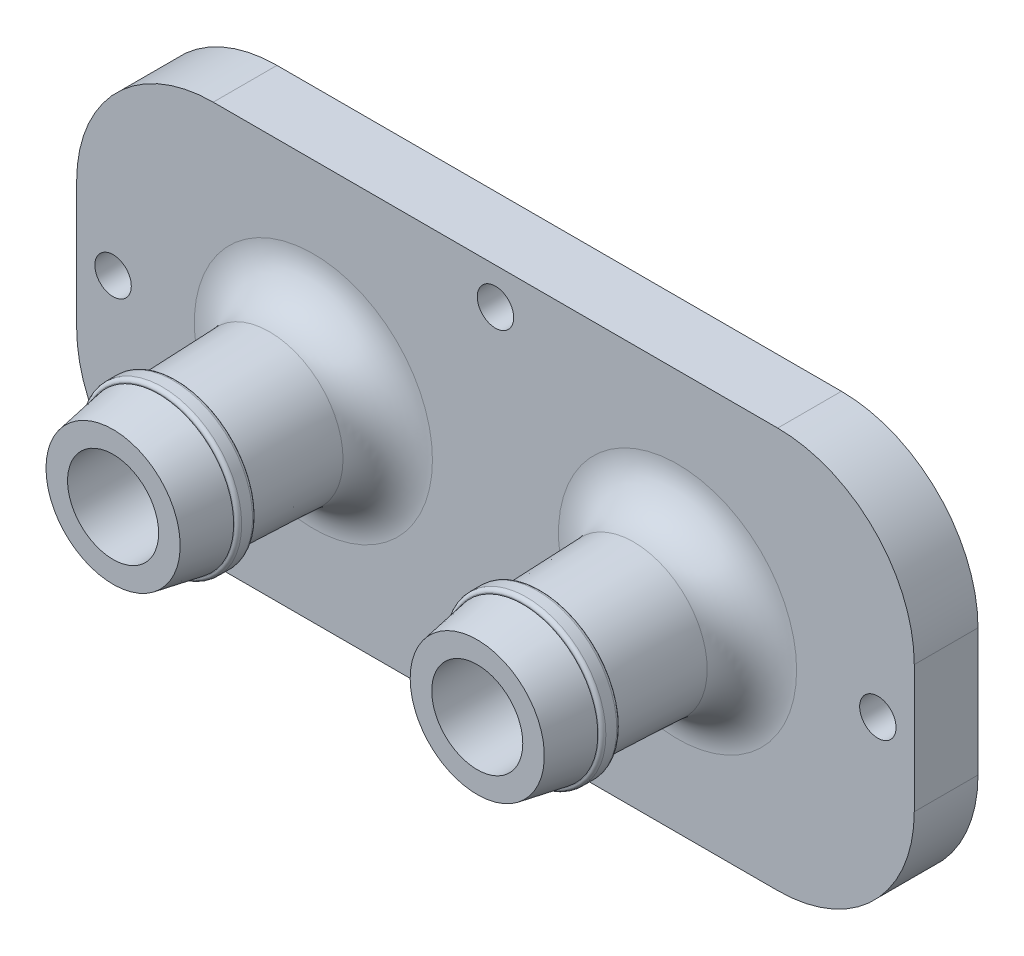
from build123d import *

# Parameters (mm, degrees)
SKETCH1_W           = 92
SKETCH1_H           = 44
SKETCH1_R           = 17
BOSS_EXTRUDE1_DEPTH = 4
FILLET1_R           = 15
BOSS_EXTRUDE2_START = 3
SKETCH2_R           = 5
BOSS_EXTRUDE2_DEPTH = 3
BOSS_EXTRUDE3_START = 15
SKETCH3_R           = 7.25
SKETCH3_R_2         = 5
BOSS_EXTRUDE3_DEPTH = 15
CHAMFER1_SIZE       = 1
CHAMFER1_SIZE_2     = 28.636253283
FILLET2_R           = 2
FILLET3_R           = 10
FILLET4_R           = 5
BOSS_EXTRUDE4_START = 2
SKETCH4_R           = 8.726188458
SKETCH4_R_2         = 5
BOSS_EXTRUDE4_DEPTH = 2
BOSS_EXTRUDE5_START = 5
SKETCH6_R           = 7.25
SKETCH6_R_2         = 5
BOSS_EXTRUDE5_DEPTH = 5
FILLET5_R           = 0.4
CHAMFER2_SIZE       = 1
CHAMFER2_SIZE_2     = 5.67128182
SKETCH8_R           = 2
CUT_EXTRUDE1_DEPTH  = 56.533773508


# Some blends are built 0.0001 mm under size
with BuildPart() as part:
    # Sketch1 → Boss-Extrude1 (new body)
    with BuildSketch(Plane.XY):
        Rectangle(SKETCH1_W, SKETCH1_H)
        with Locations((20, 0)):
            Circle(SKETCH1_R, mode=Mode.SUBTRACT)
        with Locations((-20, 0)):
            Circle(SKETCH1_R, mode=Mode.SUBTRACT)
    extrude(amount=BOSS_EXTRUDE1_DEPTH)

    # Fillet1
    fillet1_edges = [part.edges().sort_by_distance(p)[0] for p in [
        (-46, 22, 2),
        (46, 22, 2),
        (46, -22, 2),
        (-46, -22, 2),
    ]]
    fillet(fillet1_edges, radius=FILLET1_R)

    # Sketch2 → Boss-Extrude2 (add)
    with BuildSketch(Plane.XY.offset(4).offset(BOSS_EXTRUDE2_START)):
        with BuildLine():
            Line((-46, 7), (-46, -7))
            ThreePointArc((-46, -7), (-41.606601718, -17.606601718), (-31, -22))
            Line((-31, -22), (31, -22))
            ThreePointArc((31, -22), (41.606601718, -17.606601718), (46, -7))
            Line((46, -7), (46, 7))
            ThreePointArc((46, 7), (41.606601718, 17.606601718), (31, 22))
            Line((31, 22), (-31, 22))
            ThreePointArc((-31, 22), (-41.606601718, 17.606601718), (-46, 7))
        make_face()
        with Locations((-20, 0)):
            Circle(SKETCH2_R, mode=Mode.SUBTRACT)
        with Locations((20, 0)):
            Circle(SKETCH2_R, mode=Mode.SUBTRACT)
    extrude(amount=-BOSS_EXTRUDE2_DEPTH)

    # Sketch3 → Boss-Extrude3 (add)
    # profile 1 of 2: a face of its own
    with BuildSketch(Plane.XY.offset(7).offset(BOSS_EXTRUDE3_START)):
        with Locations((-20, 0)):
            Circle(SKETCH3_R)
        with Locations((-20, 0)):
            Circle(SKETCH3_R_2, mode=Mode.SUBTRACT)
    # profile 2 of 2: a face of its own
    with BuildSketch(Plane.XY.offset(7).offset(BOSS_EXTRUDE3_START)):
        with Locations((20, 0)):
            Circle(SKETCH3_R)
        with Locations((20, 0)):
            Circle(SKETCH3_R_2, mode=Mode.SUBTRACT)
    extrude(amount=-BOSS_EXTRUDE3_DEPTH)

    # Chamfer1
    # the kernel refuses this chamfer: 28.636253283, 1 mm, written as the material it adds along each edge
    with BuildSketch(Plane(origin=(-20, 0, 7), x_dir=(1, 0, 0), z_dir=(0, -1, 0))) as chamfer1_piece_1_section:
        Polygon((7.25 + CHAMFER1_SIZE, 0), (7.25, CHAMFER1_SIZE_2), (7.25, 0), align=None)
    chamfer1_piece_1 = revolve(axis=Axis((-20, 0, 7), (0, 0, 1)), mode=Mode.PRIVATE)
    chamfer1_piece_1 = split(chamfer1_piece_1, bisect_by=Plane(origin=(-27.910107183, 0, 22), z_dir=(0, 0, -1)), keep=Keep.TOP, mode=Mode.PRIVATE)
    add(chamfer1_piece_1)
    with BuildSketch(Plane(origin=(20, 0, 7), x_dir=(1, 0, 0), z_dir=(0, -1, 0))) as chamfer1_piece_2_section:
        Polygon((7.25 + CHAMFER1_SIZE, 0), (7.25, CHAMFER1_SIZE_2), (7.25, 0), align=None)
    chamfer1_piece_2 = revolve(axis=Axis((20, 0, 7), (0, 0, 1)), mode=Mode.PRIVATE)
    chamfer1_piece_2 = split(chamfer1_piece_2, bisect_by=Plane(origin=(12.089892824, 0, 22), z_dir=(0, 0, -1)), keep=Keep.TOP, mode=Mode.PRIVATE)
    add(chamfer1_piece_2)

    # Fillet2
    fillet2_edges = [part.edges().sort_by_distance(p)[0] for p in [
        (3, 0, 4),
        (-37, 0, 4),
    ]]
    fillet(fillet2_edges, radius=FILLET2_R)

    # Fillet3
    fillet3_edges = [part.edges().sort_by_distance(p)[0] for p in [
        (15, 0, 4),
        (-25, 0, 4),
    ]]
    fillet(fillet3_edges, radius=FILLET3_R - 0.0001)  # a hair under: the kernel refuses the full size

    # Fillet4
    fillet4_edges = [part.edges().sort_by_distance(p)[0] for p in [
        (11.75, 0, 7),
        (-28.25, 0, 7),
    ]]
    fillet(fillet4_edges, radius=FILLET4_R)

    # Sketch4 → Boss-Extrude4 (add)
    # profile 1 of 2: a face of its own
    with BuildSketch(Plane.XY.offset(22).offset(BOSS_EXTRUDE4_START)):
        with Locations((-20, 0)):
            Circle(SKETCH4_R)
        with Locations((-20, 0)):
            Circle(SKETCH4_R_2, mode=Mode.SUBTRACT)
    # profile 2 of 2: a face of its own
    with BuildSketch(Plane.XY.offset(22).offset(BOSS_EXTRUDE4_START)):
        with Locations((20, 0)):
            Circle(SKETCH4_R)
        with Locations((20, 0)):
            Circle(SKETCH4_R_2, mode=Mode.SUBTRACT)
    extrude(amount=-BOSS_EXTRUDE4_DEPTH)

    # Sketch6 → Boss-Extrude5 (add)
    # profile 1 of 2: a face of its own
    with BuildSketch(Plane.XY.offset(24).offset(BOSS_EXTRUDE5_START)):
        with Locations((20, 0)):
            Circle(SKETCH6_R)
        with Locations((20, 0)):
            Circle(SKETCH6_R_2, mode=Mode.SUBTRACT)
    # profile 2 of 2: a face of its own
    with BuildSketch(Plane.XY.offset(24).offset(BOSS_EXTRUDE5_START)):
        with Locations((-20, 0)):
            Circle(SKETCH6_R)
        with Locations((-20, 0)):
            Circle(SKETCH6_R_2, mode=Mode.SUBTRACT)
    extrude(amount=-BOSS_EXTRUDE5_DEPTH)

    # Fillet5
    fillet5_edges = [part.edges().sort_by_distance(p)[0] for p in [
        (-28.726188458, 0, 24),
        (-28.726188458, 0, 22),
        (11.273811542, 0, 24),
        (11.273811542, 0, 22),
        (-27.726188458, 0, 22),
        (12.273811542, 0, 22),
    ]]
    fillet(fillet5_edges, radius=FILLET5_R)

    # Chamfer2
    # the kernel refuses this chamfer: 5.67128182, 1 mm, written as the material it adds along each edge
    with BuildSketch(Plane(origin=(20, 0, 24), x_dir=(1, 0, 0), z_dir=(0, -1, 0))) as chamfer2_piece_1_section:
        Polygon((7.25 + CHAMFER2_SIZE, 0), (7.25, CHAMFER2_SIZE_2), (7.25, 0), align=None)
    chamfer2_piece_1 = revolve(axis=Axis((20, 0, 24), (0, 0, 1)), mode=Mode.PRIVATE)
    chamfer2_piece_1 = split(chamfer2_piece_1, bisect_by=Plane(origin=(12.225375497, 0, 29), z_dir=(0, 0, -1)), keep=Keep.TOP, mode=Mode.PRIVATE)
    add(chamfer2_piece_1)
    with BuildSketch(Plane(origin=(-20, 0, 24), x_dir=(1, 0, 0), z_dir=(0, -1, 0))) as chamfer2_piece_2_section:
        Polygon((7.25 + CHAMFER2_SIZE, 0), (7.25, CHAMFER2_SIZE_2), (7.25, 0), align=None)
    chamfer2_piece_2 = revolve(axis=Axis((-20, 0, 24), (0, 0, 1)), mode=Mode.PRIVATE)
    chamfer2_piece_2 = split(chamfer2_piece_2, bisect_by=Plane(origin=(-27.774624504, 0, 29), z_dir=(0, 0, -1)), keep=Keep.TOP, mode=Mode.PRIVATE)
    add(chamfer2_piece_2)

    # Sketch8 → Cut-Extrude1 (cut, through all)
    with BuildSketch(Plane.XY.offset(7)):
        with Locations((0, 18)):
            Circle(SKETCH8_R)
        with Locations((0, -18)):
            Circle(SKETCH8_R)
        with Locations((42, 0)):
            Circle(SKETCH8_R)
        with Locations((-42, 0)):
            Circle(SKETCH8_R)
    extrude(amount=-CUT_EXTRUDE1_DEPTH, mode=Mode.SUBTRACT)


solid = part.part
